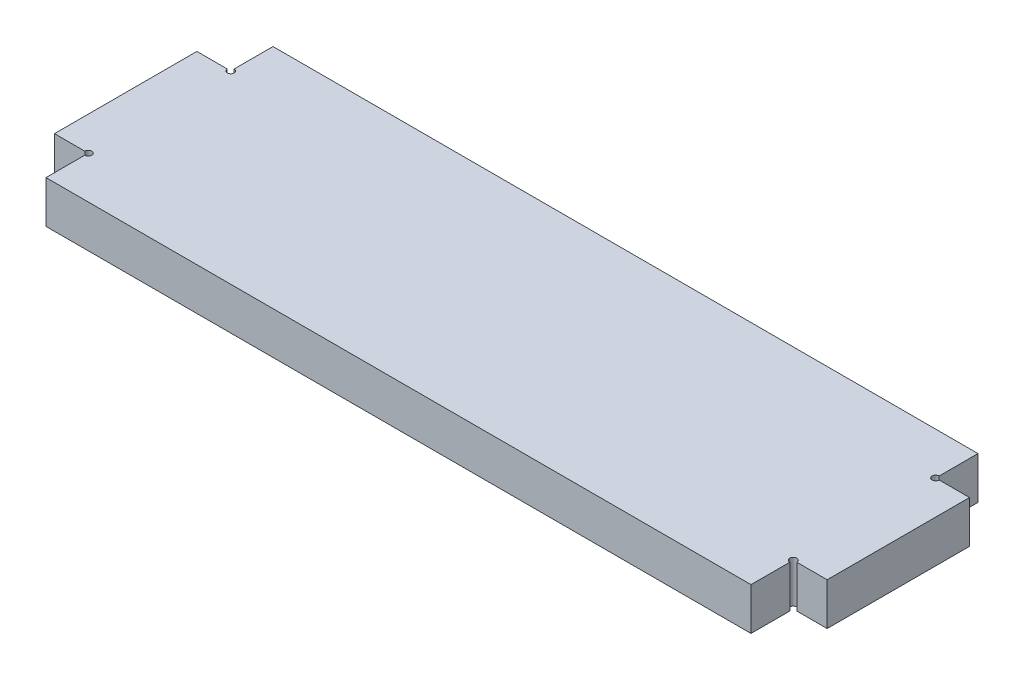
from build123d import *

# Parameters (mm, degrees)
BOSS_EXTRUDE1_DEPTH = 3


with BuildPart() as part:
    # Sketch1 → Boss-Extrude1 (new body)
    with BuildSketch(Plane(origin=(0, 0, 0), x_dir=(1, 0, 0), z_dir=(0, 1, 0))):
        with BuildLine():
            Line((0.25, 5.332122905), (2.4, 5.332122905))
            Line((2.4, 5.332122905), (2.4, -4.767877095))
            Line((2.4, -4.767877095), (0.25, -4.767877095))
            ThreePointArc((0.25, -4.767877095), (-0.176776695, -4.5911004), (0, -5.017877095))
            Line((0, -5.017877095), (0, -7.767877095))
            Line((0, -7.767877095), (-50, -7.767877095))
            Line((-50, -7.767877095), (-50, -5.017877095))
            ThreePointArc((-50, -5.017877095), (-49.823223305, -4.5911004), (-50.25, -4.767877095))
            Line((-50.25, -4.767877095), (-52.4, -4.767877095))
            Line((-52.4, -4.767877095), (-52.4, 5.332122905))
            Line((-52.4, 5.332122905), (-50.245259273, 5.332122905))
            ThreePointArc((-50.245259273, 5.332122905), (-49.826575505, 5.15869841), (-50, 5.577382178))
            Line((-50, 5.577382178), (-50, 8.332122905))
            Line((-50, 8.332122905), (0, 8.332122905))
            Line((0, 8.332122905), (0, 5.582122905))
            ThreePointArc((0, 5.582122905), (-0.176776695, 5.15534621), (0.25, 5.332122905))
        make_face()
    extrude(amount=BOSS_EXTRUDE1_DEPTH)


solid = part.part
